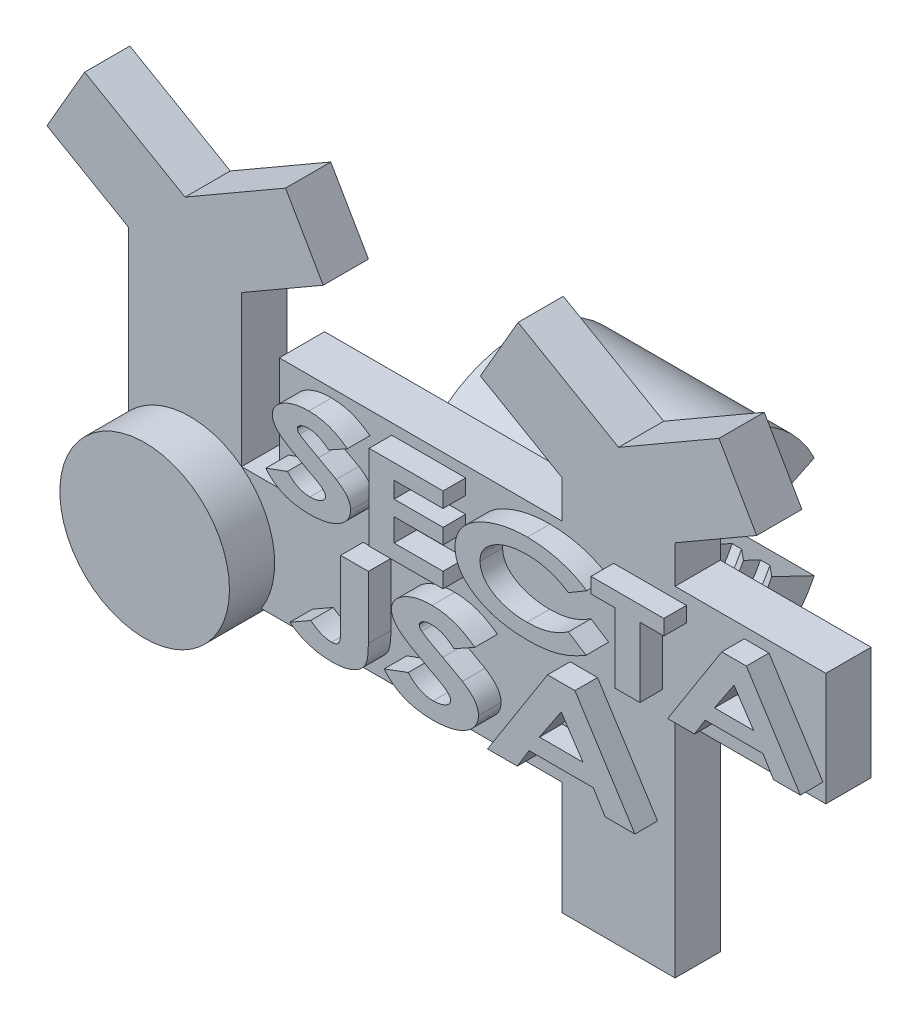
from build123d import *

# Parameters (mm, degrees)
SALIENTE_EXTRUIR1_DEPTH      = 2.4
SALIENTE_EXTRUIR2_DEPTH      = 2.4
SALIENTE_EXTRUIR2_DEPTH_BACK = 2.4
CROQUIS2_R                   = 4.5
SALIENTE_EXTRUIR3_DEPTH      = 1.2
SALIENTE_EXTRUIR4_START      = -15.5
SALIENTE_EXTRUIR4_DEPTH      = 10
REVOLUCI_N2_ANGLE            = 308.717988


# Read off the part's stored shape, not the designer's step: Revolución2
with BuildPart() as part:
    # Croquis1 → Saliente-Extruir1 (new body)
    with BuildSketch(Plane.XY):
        Polygon((-8, -12), (-14, -12), (-14, -6), (-37, -6), (-37, 8), (-41.330127019, 10.5), (-39.330127019, 13.964101615), (-34, 10.886751346), (-28.669872981, 13.964101615), (-26.669872981, 10.5), (-31, 8), (-31, 0), (-29, 0), (-29, 6), (-14, 6), (-14, 8), (-18.330127019, 10.5), (-16.330127019, 13.964101615), (-11, 10.886751346), (-5.669872981, 13.964101615), (-3.669872981, 10.5), (-8, 8), (-8, 6), (0, 6), (0, 0), (-8, 0), align=None)
    extrude(amount=SALIENTE_EXTRUIR1_DEPTH)

    # Croquis2 → Saliente-Extruir2 (add, two sides: drawn at the far end of the back side and taken through both)
    with BuildSketch(Plane.XY.offset(2.4).offset(-SALIENTE_EXTRUIR2_DEPTH_BACK)):
        with Locations((-33.744908232, -3.565877002)):
            Circle(CROQUIS2_R)
    extrude(amount=SALIENTE_EXTRUIR2_DEPTH + SALIENTE_EXTRUIR2_DEPTH_BACK)

    # Croquis4 → Saliente-Extruir3 (add)
    # profile 1 of 8: a face of its own
    with BuildSketch(Plane.XY.offset(2.4)):
        with BuildLine():
            Line((-24.192307692, 4.825075565), (-25.183894231, 4.27249143))
            add(Edge.make_bspline(
                [(-25.183894231, 4.27249143), (-25.226919521, 4.309235401), (-25.310921586, 4.380973891), (-25.44300624, 4.474503478), (-25.57494017, 4.554736812), (-25.707934149, 4.620047496), (-25.841884622, 4.67105453), (-25.976583426, 4.707083688), (-26.111905597, 4.729870519), (-26.20243685, 4.732645607), (-26.247596154, 4.734029892)],
                knots=[0, 0, 0, 0, 1.144796943, 2.235087903, 3.271950806, 4.267549238, 5.230026978, 6.168390537, 7.086346384, 8, 8, 8, 8], degree=3))
            add(Edge.make_bspline(
                [(-26.247596154, 4.734029892), (-26.289424602, 4.733153893), (-26.369562474, 4.731475594), (-26.484031555, 4.714354255), (-26.586771926, 4.685665755), (-26.6761846, 4.647005328), (-26.748660996, 4.600831216), (-26.803911953, 4.552167689), (-26.838911098, 4.497375224), (-26.84382007, 4.457984847), (-26.846153846, 4.439258257)],
                knots=[0, 0, 0, 0, 1.392129176, 2.667138632, 3.84227936, 4.935454925, 5.89858118, 6.691521191, 7.377935727, 8, 8, 8, 8], degree=3))
            add(Edge.make_bspline(
                [(-26.846153846, 4.439258257), (-26.844845537, 4.420373796), (-26.842149476, 4.381458201), (-26.816134665, 4.325733024), (-26.777704966, 4.271256116), (-26.742929276, 4.240270627), (-26.724459135, 4.223813546)],
                knots=[0, 0, 0, 0, 0.882707917, 1.819014285, 2.841630067, 4, 4, 4, 4], degree=3))
            add(Edge.make_bspline(
                [(-26.724459135, 4.223813546), (-26.70716928, 4.210697442), (-26.66689923, 4.180148536), (-26.59337581, 4.132820466), (-26.500289619, 4.0742192), (-26.385267259, 4.007155467), (-26.250202075, 3.929117481), (-26.092994818, 3.843681459), (-25.91659167, 3.74531642), (-25.790990693, 3.678511715), (-25.724759615, 3.643284699)],
                knots=[0, 0, 0, 0, 0.450074539, 1.048275106, 1.812777656, 2.732189609, 3.810011812, 5.048794557, 6.443789853, 8, 8, 8, 8], degree=3))
            add(Edge.make_bspline(
                [(-25.724759615, 3.643284699), (-25.662851598, 3.61054962), (-25.545567289, 3.548533238), (-25.379215317, 3.460234009), (-25.232592385, 3.380629208), (-25.104381152, 3.311837263), (-24.996313352, 3.251000464), (-24.90672063, 3.20082688), (-24.836479309, 3.15950506), (-24.796241404, 3.134624323), (-24.779146635, 3.12405393)],
                knots=[0, 0, 0, 0, 1.557729856, 2.951108395, 4.189202345, 5.268860485, 6.187465346, 6.947688418, 7.552933379, 8, 8, 8, 8], degree=3))
            add(Edge.make_bspline(
                [(-24.779146635, 3.12405393), (-24.745624529, 3.102367723), (-24.680599264, 3.060301409), (-24.588625488, 2.994912237), (-24.503390955, 2.931503644), (-24.427229566, 2.867043774), (-24.357014925, 2.805015658), (-24.29466236, 2.742739252), (-24.239952943, 2.680948997), (-24.177464976, 2.600954471), (-24.114353967, 2.498189698), (-24.058957494, 2.368077238), (-24.025432867, 2.231810055), (-24.021303487, 2.138659077), (-24.019230769, 2.091902488)],
                knots=[0, 0, 0, 0, 1.070878652, 2.077261218, 3.026806543, 3.919535016, 4.752941277, 5.539501526, 6.28186576, 6.965498631, 8.260851439, 9.503440935, 10.746866769, 12, 12, 12, 12], degree=3))
            add(Edge.make_bspline(
                [(-24.019230769, 2.091902488), (-24.021225883, 2.046388603), (-24.025162066, 1.956593709), (-24.053916989, 1.824825276), (-24.101962891, 1.699615496), (-24.170078124, 1.580956355), (-24.25688378, 1.468643362), (-24.361997442, 1.361487696), (-24.488019379, 1.263070384), (-24.629645969, 1.169520308), (-24.787082803, 1.085611466), (-24.956963559, 1.011461598), (-25.138821289, 0.94934789), (-25.33212297, 0.899368812), (-25.536835489, 0.859635813), (-25.752947944, 0.83114072), (-25.980779388, 0.81366997), (-26.136386151, 0.811872926), (-26.216045673, 0.810952969)],
                knots=[0, 0, 0, 0, 0.778645729, 1.536199556, 2.296471887, 3.065788088, 3.869161519, 4.720163113, 5.627776405, 6.600599383, 7.622238928, 8.677086202, 9.770036052, 10.907689888, 12.091823603, 13.337058766, 14.636764725, 16, 16, 16, 16], degree=3))
            add(Edge.make_bspline(
                [(-26.216045673, 0.810952969), (-26.278862692, 0.811613903), (-26.402188738, 0.812911487), (-26.584138058, 0.824072309), (-26.75981156, 0.841825212), (-26.929760665, 0.867140244), (-27.09350231, 0.899245573), (-27.251131566, 0.939142332), (-27.402545238, 0.985888772), (-27.54819372, 1.039742336), (-27.687679504, 1.102538784), (-27.822154113, 1.17262053), (-27.951366726, 1.251594628), (-28.076264597, 1.337864302), (-28.194814057, 1.433872974), (-28.309206927, 1.536758813), (-28.417527902, 1.648872099), (-28.485118563, 1.728831552), (-28.519230769, 1.769186142)],
                knots=[0, 0, 0, 0, 1.1656978, 2.288566092, 3.381684239, 4.4416263, 5.476209922, 6.477059963, 7.457759757, 8.415892537, 9.356930802, 10.29479133, 11.228214832, 12.165660798, 13.10971789, 14.057260176, 15.019522194, 16, 16, 16, 16], degree=3))
            Line((-28.519230769, 1.769186142), (-27.369891827, 2.195568353))
            add(Edge.make_bspline(
                [(-27.369891827, 2.195568353), (-27.326878803, 2.149617425), (-27.242766395, 2.059759915), (-27.104823389, 1.942623324), (-26.962827441, 1.842220632), (-26.815241766, 1.760731057), (-26.662944246, 1.696978834), (-26.505695985, 1.651714203), (-26.343252193, 1.623681536), (-26.232984667, 1.620335505), (-26.177283654, 1.618645276)],
                knots=[0, 0, 0, 0, 1.104549774, 2.159958392, 3.171518491, 4.154034384, 5.11440821, 6.064653456, 7.02237072, 8, 8, 8, 8], degree=3))
            add(Edge.make_bspline(
                [(-26.177283654, 1.618645276), (-26.120989658, 1.62005089), (-26.012343754, 1.622763687), (-25.85664514, 1.64771586), (-25.713942821, 1.686386449), (-25.607218871, 1.734622992), (-25.53095931, 1.778258902), (-25.482277778, 1.812604775), (-25.440114595, 1.847701985), (-25.405740827, 1.884529266), (-25.378809327, 1.92260654), (-25.360756038, 1.962489796), (-25.347985789, 2.003075864), (-25.346761569, 2.031110582), (-25.346153846, 2.045027488)],
                knots=[0, 0, 0, 0, 2.000080528, 3.860101882, 5.591711695, 7.241573856, 8.007496713, 8.712915002, 9.3571957, 9.95440764, 10.499672279, 11.006310789, 11.506715953, 12, 12, 12, 12], degree=3))
            add(Edge.make_bspline(
                [(-25.346153846, 2.045027488), (-25.348239201, 2.070942283), (-25.352586387, 2.124964954), (-25.390964671, 2.203007862), (-25.448179949, 2.280722516), (-25.514214503, 2.343308112), (-25.582059449, 2.395058844), (-25.647383562, 2.441422812), (-25.726444628, 2.492094868), (-25.819005406, 2.548325637), (-25.925335169, 2.609220624), (-26.044860486, 2.67577012), (-26.17800202, 2.747266769), (-26.271568792, 2.795754085), (-26.320612981, 2.821169315)],
                knots=[0, 0, 0, 0, 0.719620744, 1.500140495, 2.382110041, 3.407752025, 4.023146351, 4.762800511, 5.641737031, 6.64237355, 7.784062873, 9.059959673, 10.45894125, 12, 12, 12, 12], degree=3))
            add(Edge.make_bspline(
                [(-26.320612981, 2.821169315), (-26.368459463, 2.84567455), (-26.462008447, 2.89358695), (-26.598052081, 2.966124363), (-26.728282458, 3.035606872), (-26.852361866, 3.102717503), (-26.969340368, 3.16861793), (-27.079874913, 3.232097137), (-27.184213841, 3.292789495), (-27.281477135, 3.352655417), (-27.372939784, 3.409563727), (-27.457987116, 3.463803993), (-27.536153138, 3.516806133), (-27.608250882, 3.56691886), (-27.673715651, 3.615399427), (-27.732827542, 3.661463412), (-27.784903573, 3.705640291), (-27.845809442, 3.760123378), (-27.91153798, 3.827869305), (-27.981090217, 3.909608617), (-28.039650506, 3.991311051), (-28.088116794, 4.07325264), (-28.126508849, 4.154820462), (-28.152520589, 4.237055511), (-28.169956374, 4.318632083), (-28.172042788, 4.37336685), (-28.173076923, 4.400496238)],
                knots=[0, 0, 0, 0, 1.527752317, 2.987046655, 4.381534809, 5.722815918, 6.996037519, 8.197198144, 9.345466108, 10.426340658, 11.442891163, 12.407010941, 13.292840506, 14.126765819, 14.902190045, 15.60773904, 16.256140062, 16.842652159, 17.929649168, 18.935598672, 19.890598399, 20.782540177, 21.638432253, 22.445922123, 23.229718433, 24, 24, 24, 24], degree=3))
            add(Edge.make_bspline(
                [(-28.173076923, 4.400496238), (-28.171332958, 4.439115335), (-28.167872434, 4.515746655), (-28.140274372, 4.628176318), (-28.096954996, 4.736645399), (-28.034402099, 4.840036268), (-27.954790236, 4.939178338), (-27.857594728, 5.03372198), (-27.743147048, 5.123864571), (-27.613030887, 5.208721489), (-27.469978861, 5.28611098), (-27.317394775, 5.354995406), (-27.156225026, 5.412373324), (-26.987382795, 5.460394313), (-26.810220466, 5.497174122), (-26.625035089, 5.523120736), (-26.431752744, 5.538517619), (-26.300208347, 5.540640417), (-26.233173077, 5.541722199)],
                knots=[0, 0, 0, 0, 0.750986067, 1.490170878, 2.240724014, 3.017156197, 3.83291239, 4.709793601, 5.650705905, 6.664670556, 7.729957895, 8.813839263, 9.920261115, 11.057155333, 12.228423976, 13.439459984, 14.695144019, 16, 16, 16, 16], degree=3))
            add(Edge.make_bspline(
                [(-26.233173077, 5.541722199), (-26.1459499, 5.539811999), (-25.973426712, 5.536033716), (-25.71789947, 5.506014802), (-25.468743649, 5.458927461), (-25.265554368, 5.401927605), (-25.104286181, 5.345639344), (-24.980879285, 5.295174591), (-24.855593259, 5.235928582), (-24.726973154, 5.170437519), (-24.596827454, 5.094993964), (-24.463217184, 5.013324641), (-24.327779063, 4.922853281), (-24.238080357, 4.85811241), (-24.192307692, 4.825075565)],
                knots=[0, 0, 0, 0, 1.424089512, 2.816779558, 4.195891129, 5.561527259, 6.25835624, 6.984627267, 7.737611116, 8.521108524, 9.34096556, 10.193521101, 11.07816558, 12, 12, 12, 12], degree=3))
        make_face()
    # profile 2 of 8: a face of its own
    with BuildSketch(Plane.XY.offset(2.4)):
        Polygon((-23.035576923, 5.426337584), (-19.1125, 5.426337584), (-19.1125, 4.618645276), (-21.708653846, 4.618645276), (-21.708653846, 3.753260661), (-19.1125, 3.753260661), (-19.1125, 2.945568353), (-21.708653846, 2.945568353), (-21.708653846, 1.734029892), (-19.1125, 1.734029892), (-19.1125, 0.926337584), (-23.035576923, 0.926337584), align=None)
    # profile 3 of 8: a face of its own
    with BuildSketch(Plane.XY.offset(2.4)):
        with BuildLine():
            Line((-11.494230769, 4.645688546), (-12.461478365, 4.079582776))
            add(Edge.make_bspline(
                [(-12.461478365, 4.079582776), (-12.544289436, 4.131887712), (-12.70893723, 4.235882169), (-12.967709373, 4.369570214), (-13.2349627, 4.481070871), (-13.508945238, 4.574844948), (-13.791643594, 4.64568237), (-14.081359757, 4.697070998), (-14.379043474, 4.728675173), (-14.580090964, 4.732231823), (-14.681730769, 4.734029892)],
                knots=[0, 0, 0, 0, 1.000465043, 1.98915872, 2.971640436, 3.957111076, 4.945256385, 5.94622067, 6.961709345, 8, 8, 8, 8], degree=3))
            add(Edge.make_bspline(
                [(-14.681730769, 4.734029892), (-14.766807302, 4.732614733), (-14.933613121, 4.729840095), (-15.178736129, 4.708948819), (-15.41352726, 4.673751146), (-15.638708179, 4.625507751), (-15.853448947, 4.562274824), (-16.058280977, 4.48569033), (-16.25235326, 4.394501415), (-16.434067486, 4.290723345), (-16.600277398, 4.177562223), (-16.746196027, 4.055929366), (-16.870201552, 3.927577603), (-16.971329203, 3.792162), (-17.051341788, 3.650423272), (-17.107374496, 3.501164008), (-17.142253146, 3.345315182), (-17.146123081, 3.239018692), (-17.148076923, 3.185352007)],
                knots=[0, 0, 0, 0, 1.273167119, 2.496242804, 3.678550535, 4.824339787, 5.939965159, 7.025799381, 8.094030328, 9.145459928, 10.154579224, 11.099447358, 11.983659447, 12.819211474, 13.622469174, 14.41092516, 15.197712182, 16, 16, 16, 16], degree=3))
            add(Edge.make_bspline(
                [(-17.148076923, 3.185352007), (-17.147415614, 3.147727083), (-17.146108387, 3.073352918), (-17.129475318, 2.96370395), (-17.106065882, 2.856804626), (-17.070101266, 2.75393244), (-17.025862091, 2.65391101), (-16.971328936, 2.557174091), (-16.907261742, 2.463244728), (-16.833169017, 2.37324015), (-16.74995472, 2.287330187), (-16.657794645, 2.206639788), (-16.558275277, 2.129695963), (-16.45080782, 2.057129788), (-16.334226304, 1.991157083), (-16.210216908, 1.928324455), (-16.077791861, 1.871334993), (-15.938537212, 1.817777173), (-15.792564168, 1.771701839), (-15.642458064, 1.729774273), (-15.487700082, 1.69568223), (-15.329102464, 1.668203354), (-15.166867918, 1.644955994), (-15.000433419, 1.63053195), (-14.830012806, 1.619621949), (-14.714802376, 1.618973486), (-14.656490385, 1.618645276)],
                knots=[0, 0, 0, 0, 0.830945717, 1.642551973, 2.446594014, 3.246896049, 4.046756933, 4.861591236, 5.698014292, 6.556999256, 7.435410672, 8.338952563, 9.262321444, 10.214761384, 11.20258315, 12.221471147, 13.286409055, 14.388022435, 15.518142965, 16.668710983, 17.832243558, 19.019275871, 20.22635821, 21.453738207, 22.71124865, 24, 24, 24, 24], degree=3))
            add(Edge.make_bspline(
                [(-14.656490385, 1.618645276), (-14.558479025, 1.620411909), (-14.366006122, 1.623881189), (-14.084005172, 1.650038065), (-13.814796067, 1.694421697), (-13.598352905, 1.745650094), (-13.428470487, 1.797304223), (-13.29967663, 1.845079594), (-13.16705737, 1.897774166), (-13.031696922, 1.95876245), (-12.892716193, 2.025958407), (-12.751716033, 2.102246686), (-12.606883075, 2.184160309), (-12.51058721, 2.243056557), (-12.461478365, 2.273092392)],
                knots=[0, 0, 0, 0, 1.517099692, 2.97925243, 4.379421106, 5.737784246, 6.419017464, 7.126793621, 7.863581755, 8.627744198, 9.42450828, 10.252748223, 11.108938718, 12, 12, 12, 12], degree=3))
            Line((-12.461478365, 2.273092392), (-11.523978365, 1.670027488))
            add(Edge.make_bspline(
                [(-11.523978365, 1.670027488), (-11.589866389, 1.63089097), (-11.719693426, 1.55377562), (-11.915195728, 1.446317988), (-12.108473976, 1.34948377), (-12.297754192, 1.259261056), (-12.485165811, 1.179927018), (-12.670221171, 1.111080552), (-12.851582723, 1.048595885), (-13.032422653, 0.997560002), (-13.21480409, 0.952437403), (-13.402047536, 0.915306611), (-13.595238215, 0.882366907), (-13.794974582, 0.856691538), (-14.000848718, 0.835695517), (-14.213133376, 0.821796079), (-14.43134112, 0.812187513), (-14.578955449, 0.81136827), (-14.653786058, 0.810952969)],
                knots=[0, 0, 0, 0, 1.116919084, 2.20079896, 3.250609473, 4.267388355, 5.256504417, 6.215552819, 7.144850743, 8.051425286, 8.95323759, 9.882566473, 10.832956071, 11.809130983, 12.817090507, 13.848664173, 14.909416376, 16, 16, 16, 16], degree=3))
            add(Edge.make_bspline(
                [(-14.653786058, 0.810952969), (-14.722906065, 0.811438621), (-14.859691786, 0.812399709), (-15.062555949, 0.821077022), (-15.260983826, 0.833250386), (-15.454582999, 0.851296303), (-15.643403282, 0.874597786), (-15.827259539, 0.903853507), (-16.00674088, 0.936332544), (-16.180825441, 0.976788095), (-16.350605366, 1.020454944), (-16.515219787, 1.070284035), (-16.675796791, 1.124137214), (-16.830986852, 1.184720215), (-16.98194907, 1.249284398), (-17.127583541, 1.320151969), (-17.268666888, 1.395536662), (-17.404785058, 1.475557845), (-17.533832281, 1.55977608), (-17.655328935, 1.647304488), (-17.767608154, 1.738530782), (-17.872942194, 1.831381532), (-17.969705449, 1.927659287), (-18.056733746, 2.028066389), (-18.136984543, 2.130125749), (-18.207982429, 2.23578825), (-18.271536331, 2.343875109), (-18.325588208, 2.45528507), (-18.371881381, 2.569350723), (-18.409889173, 2.686463496), (-18.438566401, 2.80681331), (-18.459258447, 2.929679867), (-18.472299239, 3.055565471), (-18.474092593, 3.140548909), (-18.475, 3.183549122)],
                knots=[0, 0, 0, 0, 1.332695775, 2.637351488, 3.914573827, 5.165626706, 6.385872522, 7.582268218, 8.755001435, 9.901903064, 11.027533841, 12.134657037, 13.217484645, 14.292362361, 15.346028539, 16.38254251, 17.414187142, 18.429713001, 19.426050768, 20.38448865, 21.315585414, 22.214377371, 23.09110566, 23.945180852, 24.774994998, 25.592932072, 26.397837579, 27.190746929, 27.978303889, 28.769836126, 29.562406716, 30.361557218, 31.170975064, 32, 32, 32, 32], degree=3))
            add(Edge.make_bspline(
                [(-18.475, 3.183549122), (-18.473785493, 3.238925736), (-18.471371684, 3.348985679), (-18.446835338, 3.511020848), (-18.408980933, 3.668635775), (-18.355790343, 3.821267368), (-18.28636546, 3.9692084), (-18.202723551, 4.112393918), (-18.103189381, 4.250700647), (-17.988581396, 4.383672271), (-17.859872774, 4.511467458), (-17.71720785, 4.632192986), (-17.563026633, 4.748488266), (-17.393828314, 4.855888833), (-17.21236255, 4.957872305), (-17.017950151, 5.05352182), (-16.810256436, 5.142613144), (-16.59063275, 5.224912925), (-16.362332555, 5.299148216), (-16.12837035, 5.364251973), (-15.889855412, 5.419259798), (-15.647178925, 5.464408476), (-15.399824695, 5.498220768), (-15.148529856, 5.52396688), (-14.892531391, 5.538130641), (-14.720508462, 5.540519988), (-14.633954327, 5.541722199)],
                knots=[0, 0, 0, 0, 0.802734483, 1.595419208, 2.3713548, 3.151550955, 3.93542733, 4.738280132, 5.553519112, 6.40352961, 7.281897666, 8.181549112, 9.112540013, 10.080976543, 11.086002615, 12.130796417, 13.222189586, 14.362844853, 15.53167316, 16.70335042, 17.8843298, 19.081152094, 20.282513389, 21.504662868, 22.744459539, 24, 24, 24, 24], degree=3))
            add(Edge.make_bspline(
                [(-14.633954327, 5.541722199), (-14.560022202, 5.541038651), (-14.412680101, 5.539676383), (-14.192915704, 5.528419291), (-13.974866237, 5.510811627), (-13.759430794, 5.484144557), (-13.545483627, 5.45221806), (-13.334339569, 5.411070758), (-13.124506008, 5.364772576), (-12.918162654, 5.309484781), (-12.715876611, 5.248900726), (-12.520332919, 5.18093532), (-12.331084533, 5.108255242), (-12.149648163, 5.028005632), (-11.974851405, 4.94211841), (-11.807351876, 4.850530483), (-11.646999565, 4.75209108), (-11.544984001, 4.681037862), (-11.494230769, 4.645688546)],
                knots=[0, 0, 0, 0, 1.07027023, 2.132981633, 3.184963682, 4.2365859, 5.275089204, 6.31594048, 7.35020766, 8.385325281, 9.407824875, 10.406591267, 11.38165812, 12.34189163, 13.277662355, 14.200461515, 15.104720988, 16, 16, 16, 16], degree=3))
        make_face()
    # profile 4 of 8: a face of its own
    with BuildSketch(Plane.XY.offset(2.4)):
        Polygon((-11.260576923, 5.426337584), (-7.395192308, 5.426337584), (-7.395192308, 4.618645276), (-8.664423077, 4.618645276), (-8.664423077, 0.926337584), (-9.991346154, 0.926337584), (-9.991346154, 4.618645276), (-11.260576923, 4.618645276), align=None)
    # profile 5 of 8: a face of its own
    with BuildSketch(Plane.XY.offset(2.4)):
        Polygon((-4.322896635, 5.426337584), (-3.017608173, 5.426337584), (-0.151923077, 0.926337584), (-1.574399038, 0.926337584), (-2.138701923, 1.849414507), (-5.204507212, 1.849414507), (-5.768810096, 0.926337584), (-7.190384615, 0.926337584), align=None)
        Polygon((-3.671153846, 4.219306334), (-4.710516827, 2.657106815), (-2.631790865, 2.657106815), align=None, mode=Mode.SUBTRACT)
    # profile 6 of 8: a face of its own
    with BuildSketch(Plane.XY.offset(2.4)):
        with BuildLine():
            Line((-24.546190284, -0.25), (-23.071831309, -0.25))
            Line((-23.071831309, -0.25), (-23.071831309, -3.569310897))
            add(Edge.make_bspline(
                [(-23.071831309, -3.569310897), (-23.072406574, -3.632752689), (-23.073515346, -3.755031066), (-23.081964286, -3.931214217), (-23.098479986, -4.092503853), (-23.11832418, -4.239250217), (-23.146706496, -4.370971546), (-23.179719194, -4.488699975), (-23.22094234, -4.591138364), (-23.267655189, -4.681226196), (-23.323296841, -4.760070591), (-23.385085277, -4.834291627), (-23.45492643, -4.903906557), (-23.533194887, -4.969582476), (-23.618892979, -5.031761123), (-23.713852247, -5.088098546), (-23.81503641, -5.143201355), (-23.925223161, -5.191460535), (-24.041828184, -5.235542413), (-24.164745788, -5.273294038), (-24.292524099, -5.30687054), (-24.426861265, -5.332214891), (-24.566394664, -5.353862619), (-24.712270145, -5.36695977), (-24.86323422, -5.376642745), (-24.965844894, -5.377678982), (-25.017945091, -5.378205128)],
                knots=[0, 0, 0, 0, 1.473348785, 2.839747956, 4.094210721, 5.237871808, 6.276522632, 7.221209634, 8.073565915, 8.836606523, 9.572168199, 10.309770271, 11.077327695, 11.858625165, 12.680642535, 13.532998816, 14.421003176, 15.354680508, 16.323868113, 17.314618692, 18.33951889, 19.390254147, 20.4878881, 21.617373864, 22.79023023, 24, 24, 24, 24], degree=3))
            add(Edge.make_bspline(
                [(-25.017945091, -5.378205128), (-25.124541195, -5.376180327), (-25.334253194, -5.372196833), (-25.642922245, -5.337998), (-25.939993503, -5.284056453), (-26.22436962, -5.204898152), (-26.497449863, -5.106385983), (-26.757050991, -4.982832768), (-27.006861068, -4.840583399), (-27.161078624, -4.727061622), (-27.238497976, -4.670072115)],
                knots=[0, 0, 0, 0, 1.077199401, 2.119229805, 3.135267256, 4.125946305, 5.099631632, 6.065819531, 7.029014585, 8, 8, 8, 8], degree=3))
            Line((-27.238497976, -4.670072115), (-26.141743168, -4.042067308))
            add(Edge.make_bspline(
                [(-26.141743168, -4.042067308), (-26.083733994, -4.082431733), (-25.974060278, -4.158745809), (-25.812563056, -4.257090069), (-25.665490426, -4.335911536), (-25.528262322, -4.392413098), (-25.398768898, -4.431570652), (-25.273756589, -4.460593114), (-25.150571916, -4.476580838), (-25.069066716, -4.479387993), (-25.02896272, -4.480769231)],
                knots=[0, 0, 0, 0, 1.39335647, 2.634317501, 3.726907695, 4.680591027, 5.555299746, 6.392273383, 7.208930688, 8, 8, 8, 8], degree=3))
            add(Edge.make_bspline(
                [(-25.02896272, -4.480769231), (-24.990726454, -4.479554427), (-24.91832666, -4.477254213), (-24.817789168, -4.451643894), (-24.731514233, -4.411920036), (-24.673076726, -4.362349485), (-24.634451644, -4.312409024), (-24.611954549, -4.263727605), (-24.589733538, -4.206955), (-24.575203732, -4.139585979), (-24.561978056, -4.062773949), (-24.551919821, -3.976529786), (-24.547545341, -3.880188065), (-24.546657979, -3.813037038), (-24.546190284, -3.777644231)],
                knots=[0, 0, 0, 0, 1.383714111, 2.62004193, 3.735627911, 4.800724868, 5.362544352, 6.012331362, 6.736490893, 7.570542436, 8.504120655, 9.564458226, 10.716316565, 12, 12, 12, 12], degree=3))
            Line((-24.546190284, -3.777644231), (-24.546190284, -0.25))
        make_face()
    # profile 7 of 8: a face of its own
    with BuildSketch(Plane.XY.offset(2.4)):
        with BuildLine():
            Line((-17.42760054, -0.91806891), (-18.529363361, -1.532051282))
            add(Edge.make_bspline(
                [(-18.529363361, -1.532051282), (-18.577169239, -1.491224648), (-18.670504866, -1.411515215), (-18.817265593, -1.307593451), (-18.963858849, -1.218445302), (-19.111629937, -1.145877875), (-19.260463795, -1.089203393), (-19.410129133, -1.049170996), (-19.5604871, -1.023852295), (-19.661077382, -1.020768864), (-19.711254386, -1.019230769)],
                knots=[0, 0, 0, 0, 1.144796943, 2.235087903, 3.271950806, 4.267549238, 5.230026978, 6.168390537, 7.086346384, 8, 8, 8, 8], degree=3))
            add(Edge.make_bspline(
                [(-19.711254386, -1.019230769), (-19.75773044, -1.020204101), (-19.846772519, -1.022068878), (-19.973960387, -1.041092588), (-20.088116355, -1.072968699), (-20.187463771, -1.115924729), (-20.2679931, -1.167229298), (-20.329383052, -1.221299883), (-20.36827099, -1.2821804), (-20.373725404, -1.325947485), (-20.376318489, -1.346754808)],
                knots=[0, 0, 0, 0, 1.392129176, 2.667138632, 3.84227936, 4.935454925, 5.89858118, 6.691521191, 7.377935727, 8, 8, 8, 8], degree=3))
            add(Edge.make_bspline(
                [(-20.376318489, -1.346754808), (-20.374864812, -1.367737542), (-20.371869189, -1.410977092), (-20.342963844, -1.472893956), (-20.300264178, -1.533423853), (-20.261624522, -1.567852175), (-20.241102143, -1.586137821)],
                knots=[0, 0, 0, 0, 0.882707917, 1.819014285, 2.841630067, 4, 4, 4, 4], degree=3))
            add(Edge.make_bspline(
                [(-20.241102143, -1.586137821), (-20.221891193, -1.600711269), (-20.177146693, -1.634654498), (-20.095454004, -1.687241242), (-19.992024903, -1.752353761), (-19.864222281, -1.826869019), (-19.714149855, -1.913577893), (-19.539475124, -2.008506806), (-19.343471627, -2.117801293), (-19.203914985, -2.192028743), (-19.130324899, -2.231169872)],
                knots=[0, 0, 0, 0, 0.450074539, 1.048275106, 1.812777656, 2.732189609, 3.810011812, 5.048794557, 6.443789853, 8, 8, 8, 8], degree=3))
            add(Edge.make_bspline(
                [(-19.130324899, -2.231169872), (-19.061538213, -2.267542183), (-18.931222315, -2.336449273), (-18.74638679, -2.434559528), (-18.58347242, -2.523009306), (-18.441015496, -2.599444801), (-18.320940162, -2.667041244), (-18.221392693, -2.722789671), (-18.143346781, -2.768702805), (-18.098637998, -2.796348068), (-18.079643809, -2.808092949)],
                knots=[0, 0, 0, 0, 1.557729856, 2.951108395, 4.189202345, 5.268860485, 6.187465346, 6.947688418, 7.552933379, 8, 8, 8, 8], degree=3))
            add(Edge.make_bspline(
                [(-18.079643809, -2.808092949), (-18.042397026, -2.832188735), (-17.97014673, -2.878929084), (-17.867953646, -2.951583719), (-17.77324861, -3.022037711), (-17.688624844, -3.093659789), (-17.610608576, -3.162579918), (-17.541327949, -3.231775925), (-17.480539707, -3.300431763), (-17.411108633, -3.38931457), (-17.340985289, -3.503497651), (-17.279433653, -3.648067051), (-17.242184067, -3.799475032), (-17.237595868, -3.902976119), (-17.235292848, -3.954927885)],
                knots=[0, 0, 0, 0, 1.070878652, 2.077261218, 3.026806543, 3.919535016, 4.752941277, 5.539501526, 6.28186576, 6.965498631, 8.260851439, 9.503440935, 10.746866769, 12, 12, 12, 12], degree=3))
            add(Edge.make_bspline(
                [(-17.235292848, -3.954927885), (-17.23750964, -4.005498868), (-17.241883177, -4.105270972), (-17.273833092, -4.251680342), (-17.327217427, -4.390802319), (-17.402901019, -4.52264581), (-17.499351748, -4.647438024), (-17.616144706, -4.766499875), (-17.756169081, -4.875852445), (-17.913531958, -4.979796973), (-18.088461774, -5.07302902), (-18.27721817, -5.155417762), (-18.479282315, -5.224432993), (-18.69406196, -5.279965302), (-18.921520314, -5.324113078), (-19.161645264, -5.355774293), (-19.414791313, -5.375186238), (-19.587687716, -5.377182953), (-19.676198296, -5.378205128)],
                knots=[0, 0, 0, 0, 0.778645729, 1.536199556, 2.296471887, 3.065788088, 3.869161519, 4.720163113, 5.627776405, 6.600599383, 7.622238928, 8.677086202, 9.770036052, 10.907689888, 12.091823603, 13.337058766, 14.636764725, 16, 16, 16, 16], degree=3))
            add(Edge.make_bspline(
                [(-19.676198296, -5.378205128), (-19.745994984, -5.377470757), (-19.883023924, -5.376028997), (-20.085189835, -5.363628084), (-20.280382615, -5.343902636), (-20.469214954, -5.315774822), (-20.651150115, -5.280102234), (-20.826293733, -5.235772503), (-20.994531146, -5.183832013), (-21.156362793, -5.12399472), (-21.311346997, -5.054220889), (-21.460763229, -4.976352282), (-21.604332799, -4.888603285), (-21.743108212, -4.792748091), (-21.874829834, -4.686071789), (-22.001933023, -4.57175419), (-22.122289662, -4.447183872), (-22.197390396, -4.358340036), (-22.235292848, -4.313501603)],
                knots=[0, 0, 0, 0, 1.1656978, 2.288566092, 3.381684239, 4.4416263, 5.476209922, 6.477059963, 7.457759757, 8.415892537, 9.356930802, 10.29479133, 11.228214832, 12.165660798, 13.10971789, 14.057260176, 15.019522194, 16, 16, 16, 16], degree=3))
            Line((-22.235292848, -4.313501603), (-20.958249579, -3.83974359))
            add(Edge.make_bspline(
                [(-20.958249579, -3.83974359), (-20.91045733, -3.890800177), (-20.816999098, -3.990641855), (-20.663729092, -4.120793622), (-20.505955817, -4.232352169), (-20.341971733, -4.322896141), (-20.172752266, -4.393731944), (-19.998031976, -4.444025979), (-19.817538875, -4.475173386), (-19.6950194, -4.478891199), (-19.633129386, -4.480769231)],
                knots=[0, 0, 0, 0, 1.104549774, 2.159958392, 3.171518491, 4.154034384, 5.11440821, 6.064653456, 7.02237072, 8, 8, 8, 8], degree=3))
            add(Edge.make_bspline(
                [(-19.633129386, -4.480769231), (-19.570580502, -4.479207438), (-19.44986283, -4.476193219), (-19.276864371, -4.448468582), (-19.118306238, -4.405501262), (-18.999724072, -4.351905102), (-18.914991227, -4.303420758), (-18.860900636, -4.265258676), (-18.814052654, -4.226261776), (-18.775859579, -4.185342576), (-18.74593569, -4.143034494), (-18.72587648, -4.098719764), (-18.711687314, -4.053624133), (-18.71032707, -4.022474447), (-18.709651822, -4.007011218)],
                knots=[0, 0, 0, 0, 2.000080528, 3.860101882, 5.591711695, 7.241573856, 8.007496713, 8.712915002, 9.3571957, 9.95440764, 10.499672279, 11.006310789, 11.506715953, 12, 12, 12, 12], degree=3))
            add(Edge.make_bspline(
                [(-18.709651822, -4.007011218), (-18.711968883, -3.978217001), (-18.71679909, -3.918191811), (-18.759441628, -3.831477469), (-18.823014158, -3.745127853), (-18.896385885, -3.675588302), (-18.971769159, -3.618087489), (-19.044351506, -3.566571969), (-19.132197135, -3.510269685), (-19.235042444, -3.447791052), (-19.353186626, -3.380129956), (-19.485992533, -3.306186071), (-19.633927571, -3.22674535), (-19.737890651, -3.172870555), (-19.792384194, -3.14463141)],
                knots=[0, 0, 0, 0, 0.719620744, 1.500140495, 2.382110041, 3.407752025, 4.023146351, 4.762800511, 5.641737031, 6.64237355, 7.784062873, 9.059959673, 10.45894125, 12, 12, 12, 12], degree=3))
            add(Edge.make_bspline(
                [(-19.792384194, -3.14463141), (-19.845546952, -3.117403371), (-19.949490267, -3.064167371), (-20.100649861, -2.983570246), (-20.245350279, -2.906367458), (-20.383216288, -2.83180009), (-20.513192402, -2.758577394), (-20.636008562, -2.688044941), (-20.751940705, -2.620608988), (-20.860011032, -2.554091296), (-20.961636198, -2.490859841), (-21.056133233, -2.430592878), (-21.142984368, -2.371701612), (-21.223092973, -2.316020805), (-21.295831605, -2.262153507), (-21.361511484, -2.210971302), (-21.41937374, -2.161885882), (-21.487046928, -2.101349117), (-21.560078637, -2.026075865), (-21.637358901, -1.935254408), (-21.702425888, -1.844473925), (-21.75627732, -1.753427716), (-21.798935159, -1.662796802), (-21.827837091, -1.571424525), (-21.847210187, -1.48078389), (-21.849528424, -1.419967483), (-21.850677463, -1.389823718)],
                knots=[0, 0, 0, 0, 1.527752317, 2.987046655, 4.381534809, 5.722815918, 6.996037519, 8.197198144, 9.345466108, 10.426340658, 11.442891163, 12.407010941, 13.292840506, 14.126765819, 14.902190045, 15.60773904, 16.256140062, 16.842652159, 17.929649168, 18.935598672, 19.890598399, 20.782540177, 21.638432253, 22.445922123, 23.229718433, 24, 24, 24, 24], degree=3))
            add(Edge.make_bspline(
                [(-21.850677463, -1.389823718), (-21.848739724, -1.34691361), (-21.844894697, -1.261767699), (-21.814230184, -1.136845851), (-21.766097544, -1.01632465), (-21.696594325, -0.901445907), (-21.6081367, -0.791288051), (-21.50014169, -0.686239559), (-21.372977602, -0.586081126), (-21.228404089, -0.491795661), (-21.069457394, -0.405807337), (-20.899919521, -0.329269086), (-20.720842022, -0.265515845), (-20.533239543, -0.212159189), (-20.33639251, -0.171292735), (-20.13063098, -0.142463165), (-19.91587282, -0.125355517), (-19.769712379, -0.122996852), (-19.695228745, -0.121794872)],
                knots=[0, 0, 0, 0, 0.750986067, 1.490170878, 2.240724014, 3.017156197, 3.83291239, 4.709793601, 5.650705905, 6.664670556, 7.729957895, 8.813839263, 9.920261115, 11.057155333, 12.228423976, 13.439459984, 14.695144019, 16, 16, 16, 16], degree=3))
            add(Edge.make_bspline(
                [(-19.695228745, -0.121794872), (-19.598314104, -0.123917317), (-19.406621673, -0.128115409), (-19.122702515, -0.161469758), (-18.845862714, -0.213789026), (-18.620096846, -0.277122199), (-18.440909971, -0.339664711), (-18.303791199, -0.395736659), (-18.164584503, -0.461565558), (-18.021673276, -0.534333406), (-17.877066942, -0.618159578), (-17.728611086, -0.70890327), (-17.578124285, -0.809427003), (-17.478459057, -0.881361304), (-17.42760054, -0.91806891)],
                knots=[0, 0, 0, 0, 1.424089512, 2.816779558, 4.195891129, 5.561527259, 6.25835624, 6.984627267, 7.737611116, 8.521108524, 9.34096556, 10.193521101, 11.07816558, 12, 12, 12, 12], degree=3))
        make_face()
    # profile 8 of 8: a face of its own
    with BuildSketch(Plane.XY.offset(2.4)):
        Polygon((-13.565220732, -0.25), (-12.11490022, -0.25), (-8.930805668, -5.25), (-10.511334514, -5.25), (-11.13833772, -4.224358974), (-14.54478804, -4.224358974), (-15.171791245, -5.25), (-16.751318489, -5.25), align=None)
        Polygon((-12.841062079, -1.591145833), (-13.995909835, -3.326923077), (-11.686214322, -3.326923077), align=None, mode=Mode.SUBTRACT)
    extrude(amount=SALIENTE_EXTRUIR3_DEPTH)

    # Croquis5 → Saliente-Extruir4 (add)
    with BuildSketch(Plane.ZY.offset(29).offset(SALIENTE_EXTRUIR4_START)):
        with BuildLine():
            Line((0, 3.942080669), (0, -3.942080669))
            ThreePointArc((0, -3.942080669), (-5.582616021, -6.206913385), (-10.484519109, -2.704569172))
            Line((-10.484519109, -2.704569172), (-9.132234523, -2.055472571))
            ThreePointArc((-9.132234523, -2.055472571), (-0.1, 0), (-9.132234523, 2.055472571))
            Line((-9.132234523, 2.055472571), (-10.484519109, 2.704569172))
            ThreePointArc((-10.484519109, 2.704569172), (-5.582616021, 6.206913385), (0, 3.942080669))
        make_face()
    extrude(amount=SALIENTE_EXTRUIR4_DEPTH)

    # Revolución2 outline → Revolución2 (revolve)
    with BuildSketch(Plane(origin=(0, 0, -4.85), x_dir=(0, 0.4327310675847708, -0.9015230574682738), z_dir=(0, -0.9015230574682738, -0.4327310675847708))):
        Polygon((4.75, -22.5), (3.75, -23.5), (4.75, -23.5), align=None)
        Polygon((3.75, -22), (4.75, -22), (4.75, -21), align=None)
        Polygon((3.75, -20.5), (4.75, -20.5), (4.75, -19.5), align=None)
        Polygon((3.75, -16.5), (4.75, -17.5), (4.75, -16.5), align=None)
        Polygon((3.75, -15), (4.75, -16), (4.75, -15), align=None)
        Polygon((3.75, -13.5), (4.75, -14.5), (4.75, -13.5), align=None)
    revolve(axis=Axis((0, 0, -4.85), (1, 0, 0)), revolution_arc=REVOLUCI_N2_ANGLE)


solid = part.part
